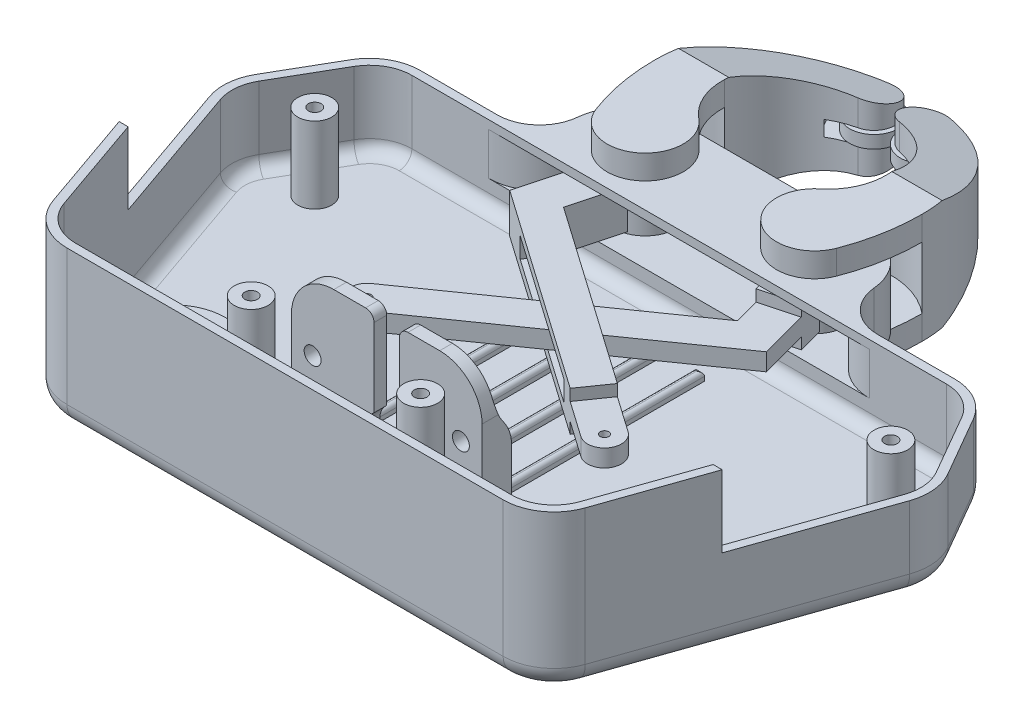
from build123d import *

# Parameters (mm, degrees)
BOSS_EXTRUDE1_DEPTH       = 2
BOSS_EXTRUDE2_DEPTH       = 35
SKETCH20_W                = 70
SKETCH20_H                = 20
CUT_EXTRUDE7_DEPTH        = 8
SKETCH21_W                = 70
SKETCH21_H                = 20
BOSS_EXTRUDE12_DEPTH      = 2
SKETCH22_W                = 66
SKETCH22_H                = 6
BOSS_EXTRUDE13_DEPTH      = 2
SKETCH23_W                = 70
SKETCH23_H                = 22
CUT_EXTRUDE8_DEPTH        = 19
SKETCH24_W                = 70
SKETCH24_H                = 22
BOSS_EXTRUDE16_DEPTH      = 2
SKETCH26_R                = 7.5
CUT_EXTRUDE9_DEPTH        = 177.062657243
BOSS_EXTRUDE18_DEPTH      = 10
SKETCH25_W                = 70
SKETCH25_H                = 2
BOSS_EXTRUDE17_DEPTH      = 17
FILLET8_R                 = 10
FILLET9_R                 = 12
BOSS_EXTRUDE22_START      = -14.3
SKETCH32_R                = 7.35
BOSS_EXTRUDE22_DEPTH      = 14.6
SKETCH34_R                = 6
SKETCH34_R_2              = 2.8
BOSS_EXTRUDE23_DEPTH      = 1.5
SKETCH36_R                = 2.5
BOSS_EXTRUDE24_DEPTH      = 1.8
BOSS_EXTRUDE25_DEPTH      = 11.2
BOSS_EXTRUDE26_DEPTH      = 5.7
BOSS_EXTRUDE27_DEPTH      = 5.7
BOSS_EXTRUDE28_DEPTH      = 11.2
BOSS_EXTRUDE29_DEPTH      = 3.6
CUT_EXTRUDE10_REACH       = 178.063
CUT_EXTRUDE11_START       = -1.5
SKETCH45_R                = 6
SKETCH45_R_2              = 5.75
CUT_EXTRUDE11_DEPTH       = 3
SKETCH8_W                 = 45
SKETCH8_H                 = 34
BOSS_EXTRUDE5_DEPTH       = 3
SKETCH9_W                 = 3
SKETCH9_H                 = 4
BOSS_EXTRUDE6_DEPTH       = 20
FILLET1_R                 = 10
FILLET2_R                 = 10
SKETCH11_R                = 12.5
BOSS_EXTRUDE9_DEPTH       = 10
CUT_EXTRUDE3_START        = -3
CUT_EXTRUDE3_DEPTH        = 5
SKETCH14_R                = 2.5
CUT_EXTRUDE4_DEPTH        = 8
SKETCH15_R                = 2
SKETCH15_R_2              = 4.65
CUT_EXTRUDE5_DEPTH        = 3
FILLET3_R                 = 10
FILLET4_R                 = 12
FILLET5_R                 = 10
FILLET6_R                 = 3
FILLET7_R                 = 5
CUT_EXTRUDE6_DEPTH        = 176.517870781
CUT_EXTRUDE6_DEPTH_BACK   = 176.517870781
SKETCH16_W                = 90
SKETCH16_H                = 20
SKETCH17_R                = 4
SKETCH17_R_2              = 1.5
BOSS_EXTRUDE10_DEPTH      = 18
SKETCH19_R                = 4
SKETCH19_R_2              = 1.5
BOSS_EXTRUDE11_DEPTH      = 35
SKETCH46_W                = 6
SKETCH46_H                = 24
CUT_EXTRUDE12_DEPTH       = 3
FILLET10_R                = 2
BOSS_EXTRUDE30_DEPTH      = 4.7
BOSS_EXTRUDE30_DEPTH_BACK = 4.7
SKETCH50_W                = 42.39696243
SKETCH50_H                = 4.8
CUT_EXTRUDE13_DEPTH       = 8
BOSS_EXTRUDE32_START      = -2
BOSS_EXTRUDE32_DEPTH      = 4.1
BOSS_EXTRUDE33_START      = -4.7
BOSS_EXTRUDE33_DEPTH      = 9.4
CUT_EXTRUDE14_DEPTH       = 2.7
CUT_EXTRUDE15_DEPTH       = 2.6
SKETCH55_R                = 1
CUT_EXTRUDE16_DEPTH       = 4.1
SKETCH56_W                = 2
SKETCH56_H                = 52
BOSS_EXTRUDE34_DEPTH      = 2
FILLET11_R                = 1
FILLET11_OF_MIRROR11_R    = 1


# Some blends are built 0.0001 mm under size
with BuildPart() as part:
    # Sketch1 → Boss-Extrude1 (new body)
    with BuildSketch(Plane(origin=(0, 0, 0), x_dir=(1, 0, 0), z_dir=(0, 1, 0))):
        Polygon((-70, -55), (-35, -55), (-35, -35), (35, -35), (35, -55), (70, -55), (84.43375673, -80), (60, -150), (-60, -150), (-84.43375673, -80), align=None)
    extrude(amount=BOSS_EXTRUDE1_DEPTH)

    # Sketch2 → Boss-Extrude2 (add)
    with BuildSketch(Plane(origin=(0, 2, 0), x_dir=(1, 0, 0), z_dir=(0, 1, 0))):
        Polygon((84.43375673, -80), (70, -55), (35, -55), (35, -35), (-35, -35), (-35, -55), (-70, -55), (-84.43375673, -80), (-60, -150), (60, -150), align=None)
        Polygon((68.845299462, -57), (33, -57), (33, -37), (-33, -37), (-33, -57), (-68.845299462, -57), (-82.243429624, -80.206242168), (-58.579769814, -148), (58.579769814, -148), (82.243429624, -80.206242168), align=None, mode=Mode.SUBTRACT)
    extrude(amount=BOSS_EXTRUDE2_DEPTH)

    # Sketch20 → Cut-Extrude7 (cut)
    with BuildSketch(Plane.XZ):
        with Locations((0, 45)):
            Rectangle(SKETCH20_W, SKETCH20_H)
    extrude(amount=-CUT_EXTRUDE7_DEPTH, mode=Mode.SUBTRACT)

    # Sketch21 → Boss-Extrude12 (add)
    with BuildSketch(Plane.XZ.offset(-8)):
        with Locations((0, 45)):
            Rectangle(SKETCH21_W, SKETCH21_H)
    extrude(amount=BOSS_EXTRUDE12_DEPTH)

    # Sketch22 → Boss-Extrude13 (add)
    with BuildSketch(Plane.XY.offset(55)):
        with Locations((0, 5)):
            Rectangle(SKETCH22_W, SKETCH22_H)
    extrude(amount=BOSS_EXTRUDE13_DEPTH)

    # Sketch23 → Cut-Extrude8 (cut)
    with BuildSketch(Plane(origin=(0, 37, 0), x_dir=(1, 0, 0), z_dir=(0, 1, 0))):
        with Locations((0, -46)):
            Rectangle(SKETCH23_W, SKETCH23_H)
    extrude(amount=-CUT_EXTRUDE8_DEPTH, mode=Mode.SUBTRACT)

    # Sketch24 → Boss-Extrude16 (add)
    with BuildSketch(Plane(origin=(0, 18, 0), x_dir=(1, 0, 0), z_dir=(0, 1, 0))):
        with Locations((0, -46)):
            Rectangle(SKETCH24_W, SKETCH24_H)
    extrude(amount=BOSS_EXTRUDE16_DEPTH)

    # Sketch26 → Cut-Extrude9 (cut, through all)
    with BuildSketch(Plane.XZ):
        with Locations(Location((20, 45, 0), (0, 0, 90))):
            Circle(SKETCH26_R)
        with Locations(Location((-20, 45, 0), (0, 0, 90))):
            Circle(SKETCH26_R)
    extrude(amount=-CUT_EXTRUDE9_DEPTH, mode=Mode.SUBTRACT)

    # Sketch27 → Boss-Extrude18 (add)
    with BuildSketch(Plane(origin=(0, 8, 0), x_dir=(1, 0, 0), z_dir=(0, 1, 0))):
        with BuildLine():
            Line((-29.5, -45), (-27.5, -45))
            ThreePointArc((-27.5, -45), (-20, -37.5), (-12.5, -45))
            Line((-12.5, -45), (-10.5, -45))
            ThreePointArc((-10.5, -45), (-20, -35.5), (-29.5, -45))
        make_face()
        with BuildLine():
            Line((29.5, -45), (27.5, -45))
            ThreePointArc((27.5, -45), (20, -37.5), (12.5, -45))
            Line((12.5, -45), (10.5, -45))
            ThreePointArc((10.5, -45), (20, -35.5), (29.5, -45))
        make_face()
    extrude(amount=BOSS_EXTRUDE18_DEPTH)

    # Sketch25 → Boss-Extrude17 (add)
    with BuildSketch(Plane(origin=(0, 20, 0), x_dir=(1, 0, 0), z_dir=(0, 1, 0))):
        with Locations((0, -56)):
            Rectangle(SKETCH25_W, SKETCH25_H)
    extrude(amount=BOSS_EXTRUDE17_DEPTH)

    # Fillet8
    # the kernel refuses this fillet: 10 mm, written as the material it adds along each edge
    with BuildSketch(Plane(origin=(-33, 8, 37), x_dir=(0, 0, 1), z_dir=(0, 1, 0))) as fillet8_piece_1:
        with BuildLine():
            CenterArc((9.771942094, 10), FILLET8_R, 192.259959565, 77.740040435)
            Line((0, 7.876524617), (-0.195438842, 7.834055109))
            ThreePointArc((-0.195438842, 7.834055109), (-0.2, 3.938262309), (-0.2, 0))
            Line((-0.2, 0), (0, -0.2))
            Line((0, -0.2), (9.771942094, -0.2))
            Line((9.771942094, -0.2), (9.771942094, 0))
        make_face()
    extrude(amount=10)
    with BuildSketch(Plane(origin=(33, 8, 37), x_dir=(-1, 0, 0), z_dir=(0, 1, 0))) as fillet8_piece_2:
        with BuildLine():
            CenterArc((10, 9.771942094), FILLET8_R, 180, 77.740040435)
            Line((0, 9.771942094), (-0.2, 9.771942094))
            Line((-0.2, 9.771942094), (-0.2, 0))
            Line((-0.2, 0), (0, -0.2))
            ThreePointArc((0, -0.2), (3.938262309, -0.2), (7.834055109, -0.195438842))
            Line((7.834055109, -0.195438842), (7.876524617, 0))
        make_face()
    extrude(amount=10)

    # Fillet9
    fillet9_edges = [part.edges().sort_by_distance(p)[0] for p in [
        (-35, 13, 35),
        (35, 13, 35),
    ]]
    fillet(fillet9_edges, radius=FILLET9_R)

    # Sketch8 → Boss-Extrude5 (add)
    with BuildSketch(Plane(origin=(0, 0, 126), x_dir=(-1, 0, 0), z_dir=(0, 0, -1))):
        with Locations((0, 19)):
            Rectangle(SKETCH8_W, SKETCH8_H)
    extrude(amount=BOSS_EXTRUDE5_DEPTH)

    # Sketch9 → Boss-Extrude6 (add)
    with BuildSketch(Plane(origin=(0, 2, 0), x_dir=(1, 0, 0), z_dir=(0, 1, 0))):
        with Locations((-21, -121)):
            Rectangle(SKETCH9_W, SKETCH9_H)
        with Locations((21, -121)):
            Rectangle(SKETCH9_W, SKETCH9_H)
    extrude(amount=BOSS_EXTRUDE6_DEPTH)

    # Fillet1
    # the kernel refuses this fillet: 10 mm, written as the material it adds along each edge
    with BuildSketch(Plane(origin=(-22.5, 22, 123), x_dir=(0, 1, 0), z_dir=(1, 0, 0))) as fillet1_piece_1:
        with BuildLine():
            CenterArc((8, -10), FILLET1_R, 90, 53.130102354)
            Line((0, -4), (-0.16, -3.88))
            ThreePointArc((-0.16, -3.88), (-0.2, -2), (-0.2, 0))
            Line((-0.2, 0), (0, 0.2))
            Line((0, 0.2), (8, 0.2))
            Line((8, 0.2), (8, 0))
        make_face()
    extrude(amount=3)
    with BuildSketch(Plane(origin=(22.5, 22, 123), x_dir=(0, 1, 0), z_dir=(-1, 0, 0))) as fillet1_piece_2:
        with BuildLine():
            CenterArc((8, 10), FILLET1_R, 216.869897646, 53.130102354)
            Line((0, 4), (-0.16, 3.88))
            ThreePointArc((-0.16, 3.88), (-0.2, 2), (-0.2, 0))
            Line((-0.2, 0), (0, -0.2))
            Line((0, -0.2), (8, -0.2))
            Line((8, -0.2), (8, 0))
        make_face()
    extrude(amount=3)

    # Fillet2
    fillet2_edges = [part.edges().sort_by_distance(p)[0] for p in [
        (-21, 22, 119),
        (21, 22, 119),
    ]]
    fillet(fillet2_edges, radius=FILLET2_R)

    # Sketch11 → Boss-Extrude9 (add)
    with BuildSketch(Plane(origin=(0, 2, 0), x_dir=(1, 0, 0), z_dir=(0, 1, 0))):
        with Locations(Location((-43.579769814, -133, 0), (0, 0, 90))):
            Circle(SKETCH11_R)
    boss_extrude9 = extrude(amount=BOSS_EXTRUDE9_DEPTH)

    # Sketch13 → Cut-Extrude3 (cut)
    with BuildSketch(Plane(origin=(0, 7, 0), x_dir=(1, 0, 0), z_dir=(0, 1, 0)).offset(CUT_EXTRUDE3_START)):
        with BuildLine():
            Line((-53.021135888, -136.295543455), (-58.294005416, -121.189357737))
            Line((-58.294005416, -121.189357737), (-39.411273269, -114.598270827))
            Line((-39.411273269, -114.598270827), (-34.138403741, -129.704456545))
            ThreePointArc((-34.138403741, -129.704456545), (-40.28422636, -142.441366074), (-53.021135888, -136.295543455))
        make_face()
    cut_extrude3 = extrude(amount=CUT_EXTRUDE3_DEPTH, mode=Mode.SUBTRACT)

    # Sketch14 → Cut-Extrude4 (cut)
    with BuildSketch(Plane(origin=(0, 12, 0), x_dir=(1, 0, 0), z_dir=(0, 1, 0))):
        with Locations(Location((-43.579769814, -133, 0), (0, 0, 270))):
            Circle(SKETCH14_R)
    cut_extrude4 = extrude(amount=-CUT_EXTRUDE4_DEPTH, mode=Mode.SUBTRACT)

    # Sketch15 → Cut-Extrude5 (cut)
    with BuildSketch(Plane.XY.offset(126)):
        with Locations((17.5, 20)):
            Circle(SKETCH15_R)
        with Locations((-17.5, 20)):
            Circle(SKETCH15_R)
        with Locations((0, 12)):
            Circle(SKETCH15_R_2)
    extrude(amount=-CUT_EXTRUDE5_DEPTH, mode=Mode.SUBTRACT)

    # Fillet3
    # the kernel refuses this fillet: 10 mm, written as the material it adds along each edge
    with BuildSketch(Plane(origin=(-35, 20, 55), x_dir=(-1, 0, 0), z_dir=(0, -1, 0)), Plane(origin=(35, 6, 55), x_dir=(1, 0, 0), z_dir=(0, 1, 0))) as fillet3_piece_1:
        with BuildLine():
            CenterArc((9.9089023, 10), FILLET3_R, 185.21590857, 84.78409143)
            Line((-0.049689654, 9.090909091), (-1.04554885, 9))
            ThreePointArc((-1.04554885, 9), (-1, 8), (-1, 0))
            Line((-1, 0), (0, -1))
            Line((0, -1), (9.9089023, -1))
            Line((9.9089023, -1), (9.9089023, 0))
        make_face()
    extrude(amount=14)
    with BuildSketch(Plane(origin=(58.579769814, 2, 148), x_dir=(0.3295543454864914, 0, -0.9441366073672656), z_dir=(0, 1, 0)), Plane(origin=(-58.579769814, 2, 148), x_dir=(1, 0, 0), z_dir=(0, 1, 0))) as fillet3_piece_2:
        with BuildLine():
            CenterArc((FILLET3_R * 0.710115092754, FILLET3_R), FILLET3_R, 199.241728317, 70.758271683)
            Line((-FILLET3_R * 0.234021514613, FILLET3_R * 0.670445654514), (0, 0))
            Line((0, 0), (FILLET3_R * 0.710115092754, 0))
        make_face()
    extrude(amount=35)
    with BuildSketch(Plane(origin=(82.243429624, 2, 80.206242168), x_dir=(-0.49999999999999883, 0, -0.8660254037844394), z_dir=(0, 1, 0))) as fillet3_piece_3:
        with BuildLine():
            CenterArc((FILLET3_R * 0.45827629813, FILLET3_R), FILLET3_R, 220.758271683, 49.241728317)
            Line((-FILLET3_R * 0.299194440672, FILLET3_R * 0.34713088612), (0, 0))
            Line((0, 0), (FILLET3_R * 0.45827629813, 0))
        make_face()
    extrude(amount=35)
    with BuildSketch(Plane(origin=(68.845299462, 2, 57), x_dir=(0.49999999999999817, 0, 0.8660254037844396), z_dir=(0, 1, 0)), Plane(origin=(-68.845299462, 2, 57), x_dir=(1, 0, 0), z_dir=(0, 1, 0))) as fillet3_piece_4:
        with BuildLine():
            CenterArc((FILLET3_R * 0.57735026919, -FILLET3_R), FILLET3_R, 90, 60)
            Line((-FILLET3_R * 0.288675134595, -FILLET3_R * 0.5), (0, 0))
            Line((0, 0), (FILLET3_R * 0.57735026919, 0))
        make_face()
    extrude(amount=35)
    with BuildSketch(Plane(origin=(-82.243429624, 2, 80.206242168), x_dir=(0.5000000000000008, 0, -0.8660254037844383), z_dir=(0, 1, 0))) as fillet3_piece_5:
        with BuildLine():
            CenterArc((FILLET3_R * 0.45827629813, -FILLET3_R), FILLET3_R, 90, 49.241728317)
            Line((-FILLET3_R * 0.299194440672, -FILLET3_R * 0.34713088612), (0, 0))
            Line((0, 0), (FILLET3_R * 0.45827629813, 0))
        make_face()
    extrude(amount=35)

    # Fillet4
    # the kernel refuses this fillet: 12 mm, written as the material it takes off along each edge
    with BuildSketch(Plane(origin=(-60, -21.303452783, 150), x_dir=(-0.3295543454864913, 0, -0.9441366073672655), z_dir=(0, 1, 0)), Plane(origin=(60, 58.303452783, 150), x_dir=(0.3295543454864903, 0, -0.9441366073672659), z_dir=(0, -1, 0))) as fillet4_piece_1:
        with BuildLine():
            CenterArc((FILLET4_R * 0.710115092754, -FILLET4_R), FILLET4_R, 90, 70.758271683)
            Line((-FILLET4_R * 0.234021514613, -FILLET4_R * 0.670445654514), (0, 0))
            Line((0, 0), (FILLET4_R * 0.710115092754, 0))
        make_face()
    extrude(amount=79.606905565, mode=Mode.SUBTRACT)
    with BuildSketch(Plane(origin=(-84.43375673, -13.748288944, 80), x_dir=(0.3295543454864903, 0, 0.944136607367266), z_dir=(0, 1, 0))) as fillet4_piece_2:
        with BuildLine():
            CenterArc((FILLET4_R * 0.45827629813, FILLET4_R), FILLET4_R, 220.758271683, 49.241728317)
            Line((-FILLET4_R * 0.299194440672, FILLET4_R * 0.34713088612), (0, 0))
            Line((0, 0), (FILLET4_R * 0.45827629813, 0))
        make_face()
    extrude(amount=64.496577888, mode=Mode.SUBTRACT)
    with BuildSketch(Plane(origin=(-70, -17.320508076, 55), x_dir=(-0.49999999999999767, 0, 0.8660254037844399), z_dir=(0, 1, 0))) as fillet4_piece_3:
        with BuildLine():
            CenterArc((FILLET4_R * 0.57735026919, FILLET4_R), FILLET4_R, 210, 60)
            Line((-FILLET4_R * 0.288675134595, FILLET4_R * 0.5), (0, 0))
            Line((0, 0), (FILLET4_R * 0.57735026919, 0))
        make_face()
    extrude(amount=71.641016151, mode=Mode.SUBTRACT)
    with BuildSketch(Plane(origin=(-33, 8, 57), x_dir=(-1, 0, 0), z_dir=(0, 1, 0))) as fillet4_piece_4:
        with BuildLine():
            CenterArc((11.928525286, -12), FILLET4_R, 90, 85.380232139)
            Line((-0.032488506, -11.03348613), (-1.228589886, -10.936834743))
            ThreePointArc((-1.228589886, -10.936834743), (-1.2, -10.228057906), (-1.2, 0))
            Line((-1.2, 0), (0, 1.2))
            Line((0, 1.2), (11.928525286, 1.2))
            Line((11.928525286, 1.2), (11.928525286, 0))
        make_face()
    extrude(amount=10, mode=Mode.SUBTRACT)
    with BuildSketch(Plane(origin=(33, 8, 57), x_dir=(1, 0, 0), z_dir=(0, 1, 0))) as fillet4_piece_5:
        with BuildLine():
            CenterArc((11.928525286, 12), FILLET4_R, 184.619767861, 85.380232139)
            Line((-0.032488506, 11.03348613), (-1.228589886, 10.936834743))
            ThreePointArc((-1.228589886, 10.936834743), (-1.2, 10.228057906), (-1.2, 0))
            Line((-1.2, 0), (0, -1.2))
            Line((0, -1.2), (11.928525286, -1.2))
            Line((11.928525286, -1.2), (11.928525286, 0))
        make_face()
    extrude(amount=10, mode=Mode.SUBTRACT)
    with BuildSketch(Plane(origin=(70, 54.320508076, 55), x_dir=(-1, 0, 0), z_dir=(0, -1, 0))) as fillet4_piece_6:
        with BuildLine():
            CenterArc((FILLET4_R * 0.57735026919, -FILLET4_R), FILLET4_R, 90, 60)
            Line((-FILLET4_R * 0.288675134595, -FILLET4_R * 0.5), (0, 0))
            Line((0, 0), (FILLET4_R * 0.57735026919, 0))
        make_face()
    extrude(amount=71.641016151, mode=Mode.SUBTRACT)
    with BuildSketch(Plane(origin=(84.43375673, 50.748288944, 80), x_dir=(-0.499999999999997, 0, -0.8660254037844405), z_dir=(0, -1, 0))) as fillet4_piece_7:
        with BuildLine():
            CenterArc((FILLET4_R * 0.45827629813, -FILLET4_R), FILLET4_R, 90, 49.241728317)
            Line((-FILLET4_R * 0.299194440672, -FILLET4_R * 0.34713088612), (0, 0))
            Line((0, 0), (FILLET4_R * 0.45827629813, 0))
        make_face()
    extrude(amount=64.496577888, mode=Mode.SUBTRACT)

    # Fillet5
    fillet5_edges = [part.edges().sort_by_distance(p)[0] for p in [
        (22.5, 36, 124.5),
        (-22.5, 36, 124.5),
    ]]
    fillet(fillet5_edges, radius=FILLET5_R)

    # Fillet6
    # the kernel refuses this fillet: 3 mm, written as the material it adds along each edge
    with BuildSketch(Plane(origin=(-51.478618887, 2, 148), x_dir=(0, 0, -1), z_dir=(1, 0, 0))) as fillet6_piece_1:
        with BuildLine():
            CenterArc((FILLET6_R, FILLET6_R), FILLET6_R, 180, 90)
            Line((0, FILLET6_R), (0, 0))
            Line((0, 0), (FILLET6_R, 0))
        make_face()
    extrude(amount=102.957237774)
    with BuildSketch(Plane(origin=(-63.07179677, 2, 57), x_dir=(0, 0, 1), z_dir=(1, 0, 0))) as fillet6_piece_2:
        with BuildLine():
            CenterArc((FILLET6_R, -FILLET6_R), FILLET6_R, 90, 90)
            Line((0, -FILLET6_R), (0, 0))
            Line((0, 0), (FILLET6_R, 0))
        make_face()
    extrude(amount=126.143593539)
    with BuildSketch(Plane(origin=(-71.732050808, 2, 62), x_dir=(0.8660254037844374, 0, 0.5000000000000022), z_dir=(-0.5000000000000022, 0, 0.8660254037844374)), Plane(origin=(79.952048133, 2, 76.237453006), x_dir=(-0.8660254037844397, 0, 0.4999999999999984), z_dir=(-0.49999999999999833, 0, -0.8660254037844397))) as fillet6_piece_3:
        with BuildLine():
            CenterArc((FILLET6_R, FILLET6_R), FILLET6_R, 180, 90)
            Line((0, FILLET6_R), (0, 0))
            Line((0, 0), (FILLET6_R, 0))
        make_face()
    extrude(amount=16.439994652)
    with BuildSketch(Plane(origin=(-80.733160169, 2, 84.532996461), x_dir=(0.9441366073672651, 0, -0.329554345486493), z_dir=(0.329554345486493, 0, 0.9441366073672651)), Plane(origin=(60.919984961, 2, 141.295543455), x_dir=(-0.9441366073672659, 0, -0.32955434548649076), z_dir=(0.3295543454864908, 0, -0.9441366073672659))) as fillet6_piece_4:
        with BuildLine():
            CenterArc((FILLET6_R, FILLET6_R), FILLET6_R, 180, 90)
            Line((0, FILLET6_R), (0, 0))
            Line((0, 0), (FILLET6_R, 0))
        make_face()
    extrude(amount=60.121116532)
    with BuildSketch(Plane(origin=(-63.07179677, 2, 67), x_dir=(0, 0, -1), z_dir=(1, 0, 0))) as fillet6_piece_5:
        with BuildLine():
            CenterArc((10 - FILLET6_R, FILLET6_R), FILLET6_R, 270, 90)
            Line((10, FILLET6_R), (10, 0))
            Line((10, 0), (10 - FILLET6_R, 0))
        make_face()
    revolve(axis=Axis((-63.07179677, 2, 67), (0, 1, 0)), revolution_arc=60)
    with BuildSketch(Plane(origin=(-71.291794096, 2, 81.237453006), x_dir=(-0.8660254037843294, 0, -0.5000000000001894), z_dir=(0.5000000000001894, 0, -0.8660254037843294))) as fillet6_piece_6:
        with BuildLine():
            CenterArc((10 - FILLET6_R, FILLET6_R), FILLET6_R, 270, 90)
            Line((10, FILLET6_R), (10, 0))
            Line((10, 0), (10 - FILLET6_R, 0))
        make_face()
    revolve(axis=Axis((-71.291794096, 2, 81.237453006), (0, 1, 0)), revolution_arc=49.241728317)
    with BuildSketch(Plane(origin=(63.07179677, 2, 67), x_dir=(0.8660254037843291, 0, -0.5000000000001898), z_dir=(0.5000000000001898, 0, 0.8660254037843291))) as fillet6_piece_7:
        with BuildLine():
            CenterArc((10 - FILLET6_R, FILLET6_R), FILLET6_R, 270, 90)
            Line((10, FILLET6_R), (10, 0))
            Line((10, 0), (10 - FILLET6_R, 0))
        make_face()
    revolve(axis=Axis((63.07179677, 2, 67), (0, 1, 0)), revolution_arc=60)
    with BuildSketch(Plane(origin=(71.291794096, 2, 81.237453006), x_dir=(0.9441366073673358, 0, 0.32955434548629065), z_dir=(-0.32955434548629065, 0, 0.9441366073673358))) as fillet6_piece_8:
        with BuildLine():
            CenterArc((10 - FILLET6_R, FILLET6_R), FILLET6_R, 270, 90)
            Line((10, FILLET6_R), (10, 0))
            Line((10, 0), (10 - FILLET6_R, 0))
        make_face()
    revolve(axis=Axis((71.291794096, 2, 81.237453006), (0, 1, 0)), revolution_arc=49.241728317)
    with BuildSketch(Plane(origin=(-51.478618887, 2, 138), x_dir=(-0.9441366073672636, 0, 0.32955434548649704), z_dir=(-0.32955434548649704, 0, -0.9441366073672636))) as fillet6_piece_9:
        with BuildLine():
            CenterArc((10 - FILLET6_R, FILLET6_R), FILLET6_R, 270, 90)
            Line((10, FILLET6_R), (10, 0))
            Line((10, 0), (10 - FILLET6_R, 0))
        make_face()
    revolve(axis=Axis((-51.478618887, 2, 138), (0, 1, 0)), revolution_arc=70.758271683)
    with BuildSketch(Plane(origin=(51.478618887, 2, 138), x_dir=(0, 0, 1), z_dir=(-1, 0, 0))) as fillet6_piece_10:
        with BuildLine():
            CenterArc((10 - FILLET6_R, FILLET6_R), FILLET6_R, 270, 90)
            Line((10, FILLET6_R), (10, 0))
            Line((10, 0), (10 - FILLET6_R, 0))
        make_face()
    revolve(axis=Axis((51.478618887, 2, 138), (0, 1, 0)), revolution_arc=70.758271683)

    # Fillet7
    fillet7_edges = [part.edges().sort_by_distance(p)[0] for p in [
        (0, 0, 150),
        (0, 0, 55),
        (77.574100278, 0, 68.118726503),
        (72.71484578, 0, 113.573378649),
        (-72.71484578, 0, 113.573378649),
        (-77.574100278, 0, 68.118726503),
        (83.238948111, 0, 80.112503707),
        (58.426430566, 0, 147.784064231),
        (69.07179677, 0, 56.607695155),
        (-69.07179677, 0, 56.607695155),
        (-83.238948111, 0, 80.112503707),
        (-58.426430566, 0, 147.784064231),
    ]]
    fillet(fillet7_edges, radius=FILLET7_R)

    # Sketch16 → Cut-Extrude6 (cut, two sides: drawn at the far end of the back side and taken through both)
    with BuildSketch(Plane(origin=(0, 0, 0), x_dir=(0, 0, -1), z_dir=(1, 0, 0)).offset(-CUT_EXTRUDE6_DEPTH_BACK)):
        with Locations((-73, 30)):
            Rectangle(SKETCH16_W, SKETCH16_H)
    extrude(amount=CUT_EXTRUDE6_DEPTH + CUT_EXTRUDE6_DEPTH_BACK, mode=Mode.SUBTRACT)

    # Sketch17 → Boss-Extrude10 (add)
    # profile 1 of 2: a face of its own
    with BuildSketch(Plane(origin=(0, 2, 0), x_dir=(1, 0, 0), z_dir=(0, 1, 0))):
        with Locations(Location((-68, -75, 0), (0, 0, 90))):
            Circle(SKETCH17_R)
        with Locations(Location((-68, -75, 0), (0, 0, 270))):
            Circle(SKETCH17_R_2, mode=Mode.SUBTRACT)
    # profile 2 of 2: a face of its own
    with BuildSketch(Plane(origin=(0, 2, 0), x_dir=(1, 0, 0), z_dir=(0, 1, 0))):
        with Locations(Location((68, -75, 0), (0, 0, 90))):
            Circle(SKETCH17_R)
        with Locations(Location((68, -75, 0), (0, 0, 90))):
            Circle(SKETCH17_R_2, mode=Mode.SUBTRACT)
    extrude(amount=BOSS_EXTRUDE10_DEPTH)

    # Sketch19 → Boss-Extrude11 (add)
    # profile 1 of 2: a face of its own
    with BuildSketch(Plane(origin=(0, 2, 0), x_dir=(1, 0, 0), z_dir=(0, 1, 0))):
        with Locations(Location((-20, -138, 0), (0, 0, 90))):
            Circle(SKETCH19_R)
        with Locations(Location((-20, -138, 0), (0, 0, 270))):
            Circle(SKETCH19_R_2, mode=Mode.SUBTRACT)
    # profile 2 of 2: a face of its own
    with BuildSketch(Plane(origin=(0, 2, 0), x_dir=(1, 0, 0), z_dir=(0, 1, 0))):
        with Locations(Location((20, -138, 0), (0, 0, 90))):
            Circle(SKETCH19_R)
        with Locations(Location((20, -138, 0), (0, 0, 90))):
            Circle(SKETCH19_R_2, mode=Mode.SUBTRACT)
    extrude(amount=BOSS_EXTRUDE11_DEPTH)

    # Sketch46 → Cut-Extrude12 (cut)
    with BuildSketch(Plane.XY.offset(126)):
        with Locations((0, 24)):
            Rectangle(SKETCH46_W, SKETCH46_H)
    extrude(amount=-CUT_EXTRUDE12_DEPTH, mode=Mode.SUBTRACT)

    # Fillet10
    fillet10_edges = [part.edges().sort_by_distance(p)[0] for p in [
        (3, 36, 124.5),
        (-3, 36, 124.5),
    ]]
    fillet(fillet10_edges, radius=FILLET10_R)

    # Mirror9: Boss-Extrude9, Cut-Extrude3, Cut-Extrude4 across plane
    add(boss_extrude9.mirror(Plane(origin=(0, 0, 0), x_dir=(0, 0, 1), z_dir=(1, 0, 0))))
    add(cut_extrude3.mirror(Plane(origin=(0, 0, 0), x_dir=(0, 0, 1), z_dir=(1, 0, 0))), mode=Mode.SUBTRACT)
    add(cut_extrude4.mirror(Plane(origin=(0, 0, 0), x_dir=(0, 0, 1), z_dir=(1, 0, 0))), mode=Mode.SUBTRACT)

    # Sketch56 → Boss-Extrude34 (add)
    with BuildSketch(Plane(origin=(0, 2, 0), x_dir=(1, 0, 0), z_dir=(0, 1, 0))):
        with Locations((-15, -93)):
            Rectangle(SKETCH56_W, SKETCH56_H)
        with Locations((-5, -93)):
            Rectangle(SKETCH56_W, SKETCH56_H)
    boss_extrude34 = extrude(amount=BOSS_EXTRUDE34_DEPTH)

    # Fillet11
    fillet11_edges = [part.edges().sort_by_distance(p)[0] for p in [
        (-16, 4, 93),
        (-15, 4, 119),
        (-14, 4, 93),
        (-15, 4, 67),
        (-6, 4, 93),
        (-5, 4, 119),
        (-4, 4, 93),
        (-5, 4, 67),
    ]]
    fillet(fillet11_edges, radius=FILLET11_R - 0.0001)  # a hair under: the kernel refuses the full size

    # Mirror11: Boss-Extrude34 across plane
    add(boss_extrude34.mirror(Plane(origin=(0, 0, 0), x_dir=(0, 0, 1), z_dir=(1, 0, 0))))

    # Fillet11 of Mirror11
    fillet11_of_mirror11_edges = [part.edges().sort_by_distance(p)[0] for p in [
        (16, 4, 93),
        (15, 4, 119),
        (14, 4, 93),
        (15, 4, 67),
        (6, 4, 93),
        (5, 4, 119),
        (4, 4, 93),
        (5, 4, 67),
    ]]
    fillet(fillet11_of_mirror11_edges, radius=FILLET11_OF_MIRROR11_R - 0.0001)  # a hair under: the kernel refuses the full size


with BuildPart() as body_2:
    # Sketch32 → Boss-Extrude22 (new body)
    with BuildSketch(Plane.XZ.offset(-6).offset(BOSS_EXTRUDE22_START)):
        with Locations(Location((-20, 45, 0), (0, 0, 270))):
            Circle(SKETCH32_R)
    extrude(amount=BOSS_EXTRUDE22_DEPTH)



with BuildPart() as body_3:
    # Sketch34 → Boss-Extrude23 (new, symmetric)
    with BuildSketch(Plane(origin=(0, 13, 0), x_dir=(-1, 0, 0), z_dir=(0, -1, 0))):
        with Locations(Location((6, -5, 0), (0, 0, 90))):
            Circle(SKETCH34_R)
        with Locations(Location((6, -5, 0), (0, 0, 90))):
            Circle(SKETCH34_R_2, mode=Mode.SUBTRACT)
    extrude(amount=BOSS_EXTRUDE23_DEPTH, both=True)

    # Sketch45 → Cut-Extrude11 (cut)
    with BuildSketch(Plane(origin=(0, 13, 0), x_dir=(-1, 0, 0), z_dir=(0, -1, 0)).offset(CUT_EXTRUDE11_START)):
        with Locations((6, -5)):
            Circle(SKETCH45_R)
        with Locations(Location((6, -5, 0), (0, 0, 90))):
            Circle(SKETCH45_R_2, mode=Mode.SUBTRACT)
    extrude(amount=CUT_EXTRUDE11_DEPTH, mode=Mode.SUBTRACT)


with BuildPart() as body_4:
    # Sketch36 → Boss-Extrude24 (new, symmetric)
    with BuildSketch(Plane(origin=(0, 13, 0), x_dir=(-1, 0, 0), z_dir=(0, -1, 0))):
        with Locations(Location((6, -5, 0), (0, 0, 90))):
            Circle(SKETCH36_R)
    extrude(amount=BOSS_EXTRUDE24_DEPTH, both=True)

    # Sketch37 → Boss-Extrude25 (add)
    with BuildSketch(Plane.XZ.offset(-11.2)):
        with BuildLine():
            ThreePointArc((-4.934956272, 9.885251463), (-1.129982148, 3.867336714), (-7.200065171, 0.146151673))
            ThreePointArc((-7.200065171, 0.146151673), (-24.716854546, 11.474930279), (-31.542149188, 31.187730378))
            ThreePointArc((-31.542149188, 31.187730378), (-25.81316871, 27.964534948), (-19.308915953, 27.01327148))
            ThreePointArc((-19.308915953, 27.01327148), (-15.045508823, 15.995777869), (-4.934956272, 9.885251463))
        make_face()
    extrude(amount=BOSS_EXTRUDE25_DEPTH)


with BuildPart() as body_2_1:
    add(body_2.part)

    add(body_4.part)  # Boss-Extrude26 merges body 4
    # Sketch39 → Boss-Extrude26 (add)
    with BuildSketch(Plane.XZ.offset(-5.7)):
        with BuildLine():
            ThreePointArc((-14.335275588, 38.006367372), (-14.71217883, 52.282784308), (-28.403824694, 48.221138077))
            ThreePointArc((-28.403824694, 48.221138077), (-30.75797131, 39.84906387), (-31.542149188, 31.187730378))
            ThreePointArc((-31.542149188, 31.187730378), (-25.81316871, 27.964534948), (-19.308915953, 27.01327148))
            ThreePointArc((-19.308915953, 27.01327148), (-18.123934022, 33.098814131), (-14.335275588, 38.006367372))
        make_face()
    extrude(amount=BOSS_EXTRUDE26_DEPTH)

    # Sketch40 → Boss-Extrude27 (add)
    with BuildSketch(Plane(origin=(0, 20.3, 0), x_dir=(1, 0, 0), z_dir=(0, 1, 0))):
        with BuildLine():
            ThreePointArc((-28.403824694, -48.221138077), (-14.71217883, -52.282784308), (-14.335275588, -38.006367372))
            ThreePointArc((-14.335275588, -38.006367372), (-18.123934022, -33.098814131), (-19.308915953, -27.01327148))
            ThreePointArc((-19.308915953, -27.01327148), (-25.81316871, -27.964534948), (-31.542149188, -31.187730378))
            ThreePointArc((-31.542149188, -31.187730378), (-30.75797131, -39.84906387), (-28.403824694, -48.221138077))
        make_face()
    extrude(amount=BOSS_EXTRUDE27_DEPTH)

    # Sketch41 → Boss-Extrude28 (add)
    with BuildSketch(Plane(origin=(0, 14.8, 0), x_dir=(1, 0, 0), z_dir=(0, 1, 0))):
        with BuildLine():
            ThreePointArc((-4.934956272, -9.885251463), (-1.129982148, -3.867336714), (-7.200065171, -0.146151673))
            ThreePointArc((-7.200065171, -0.146151673), (-24.716854546, -11.474930279), (-31.542149188, -31.187730378))
            ThreePointArc((-31.542149188, -31.187730378), (-25.81316871, -27.964534948), (-19.308915953, -27.01327148))
            ThreePointArc((-19.308915953, -27.01327148), (-15.045508823, -15.995777869), (-4.934956272, -9.885251463))
        make_face()
    extrude(amount=BOSS_EXTRUDE28_DEPTH)

    # Sketch43 → Boss-Extrude29 (add)
    with BuildSketch(Plane(origin=(0, 11.2, 0), x_dir=(1, 0, 0), z_dir=(0, 1, 0))):
        with BuildLine():
            ThreePointArc((-10.587116778, -12.156001654), (-16.807664842, -18.49295009), (-19.308915953, -27.01327148))
            ThreePointArc((-19.308915953, -27.01327148), (-25.81316871, -27.964534948), (-31.542149188, -31.187730378))
            ThreePointArc((-31.542149188, -31.187730378), (-26.852995772, -14.554309311), (-14.204510666, -2.778287883))
            ThreePointArc((-14.204510666, -2.778287883), (-13.930435805, -8.059115549), (-10.587116778, -12.156001654))
        make_face()
    extrude(amount=BOSS_EXTRUDE29_DEPTH)

    # Sketch44 → Cut-Extrude10 (cut, up to next)
    with BuildSketch(Plane(origin=(0, 0, 0), x_dir=(0, 0, -1), z_dir=(1, 0, 0)), mode=Mode.PRIVATE) as cut_extrude10_sk1:
        Polygon((0, 17.8), (-26.01327148, 26), (0, 26), align=None)
    cut_extrude10_tool1 = extrude(cut_extrude10_sk1.sketch, amount=-CUT_EXTRUDE10_REACH, mode=Mode.PRIVATE) & body_2_1.part
    # Sketch44 → Cut-Extrude10 (cut, up to next)
    with BuildSketch(Plane(origin=(0, 0, 0), x_dir=(0, 0, -1), z_dir=(1, 0, 0)), mode=Mode.PRIVATE) as cut_extrude10_sk2:
        Polygon((0, 8.2), (-26.01327148, 0), (0, 0), align=None)
    cut_extrude10_tool2 = extrude(cut_extrude10_sk2.sketch, amount=-CUT_EXTRUDE10_REACH, mode=Mode.PRIVATE) & body_2_1.part
    add(cut_extrude10_tool1.solids().sort_by_distance((0, 23.266667, 8.67109))[0], mode=Mode.SUBTRACT)
    add(cut_extrude10_tool2.solids().sort_by_distance((0, 2.733333, 8.67109))[0], mode=Mode.SUBTRACT)


with BuildPart() as body_4_2:
    # Mirror8: mirrored copy
    add(body_2_1.part.mirror(Plane(origin=(0, 0, 0), x_dir=(0, 0, 1), z_dir=(1, 0, 0))))


with BuildPart() as body_5:
    # Mirror8 2: mirrored copy
    add(body_3.part.mirror(Plane(origin=(0, 0, 0), x_dir=(0, 0, 1), z_dir=(1, 0, 0))))


with BuildPart() as body_6:
    # Sketch49 → Boss-Extrude30 (new, two sides: drawn at the far end of the back side and taken through both)
    with BuildSketch(Plane(origin=(0, 13, 0), x_dir=(-1, 0, 0), z_dir=(0, -1, 0)).offset(-BOSS_EXTRUDE30_DEPTH_BACK)):
        with BuildLine():
            Line((30.307813145, -66.662172993), (-25.719698453, -105.893058961))
            ThreePointArc((-25.719698453, -105.893058961), (-31.290612375, -104.910756529), (-30.308309943, -99.339842606))
            Line((-30.308309943, -99.339842606), (17.905213591, -65.580369984))
            Line((17.905213591, -65.580369984), (20.520383785, -63.749208101))
            Line((20.520383785, -63.749208101), (17.331602636, -51.848514839))
            ThreePointArc((17.331602636, -51.848514839), (21.902319982, -52.099554823), (25.735157325, -49.596789147))
            Line((25.735157325, -49.596789147), (30.307813145, -66.662172993))
        make_face()
    extrude(amount=BOSS_EXTRUDE30_DEPTH + BOSS_EXTRUDE30_DEPTH_BACK)

    # Sketch50 → Cut-Extrude13 (cut)
    with BuildSketch(Plane(origin=(-41.291941298, 0, 58.971003659), x_dir=(0.819152044288991, 0, 0.5735764363510474), z_dir=(-0.5735764363510473, 0, 0.8191520442889909))):
        with Locations((44.607625744, 13)):
            Rectangle(SKETCH50_W, SKETCH50_H)
    extrude(amount=-CUT_EXTRUDE13_DEPTH, mode=Mode.SUBTRACT)


with BuildPart() as body_2_2:
    add(body_2_1.part)

    add(body_6.part)  # Boss-Extrude32 merges body 6

    add(body_4_2.part)  # Boss-Extrude32 merges body 4 2
    # Sketch51 → Boss-Extrude32 (add)
    with BuildSketch(Plane(origin=(0, 13, 0), x_dir=(-1, 0, 0), z_dir=(0, -1, 0)).offset(BOSS_EXTRUDE32_START)):
        with BuildLine():
            Line((30.308309943, -99.339842606), (-20.520383785, -63.749208101))
            Line((-20.520383785, -63.749208101), (-17.331602636, -51.848514839))
            ThreePointArc((-17.331602636, -51.848514839), (-21.902319982, -52.099554823), (-25.735157325, -49.596789147))
            Line((-25.735157325, -49.596789147), (-30.307813145, -66.662172993))
            Line((-30.307813145, -66.662172993), (25.719698453, -105.893058961))
            ThreePointArc((25.719698453, -105.893058961), (31.290612375, -104.910756529), (30.308309943, -99.339842606))
        make_face()
    extrude(amount=BOSS_EXTRUDE32_DEPTH)

    # Sketch52 → Boss-Extrude33 (add)
    with BuildSketch(Plane(origin=(0, 13, 0), x_dir=(-1, 0, 0), z_dir=(0, -1, 0)).offset(BOSS_EXTRUDE33_START)):
        with BuildLine():
            Line((-25.735157325, -49.596789147), (-27.307605886, -55.465247069))
            Line((-27.307605886, -55.465247069), (-18.904051197, -57.716972762))
            Line((-18.904051197, -57.716972762), (-17.331602636, -51.848514839))
            ThreePointArc((-17.331602636, -51.848514839), (-21.902319982, -52.099554823), (-25.735157325, -49.596789147))
        make_face()
    extrude(amount=BOSS_EXTRUDE33_DEPTH)

    # Sketch53 → Cut-Extrude14 (cut)
    with BuildSketch(Plane(origin=(0, 17.7, 0), x_dir=(1, 0, 0), z_dir=(0, 1, 0))):
        with BuildLine():
            Line((21.879223866, -93.437732995), (30.308309943, -99.339842606))
            ThreePointArc((30.308309943, -99.339842606), (31.290612375, -104.910756529), (25.719698453, -105.893058961))
            Line((25.719698453, -105.893058961), (17.290612375, -99.990949349))
            Line((17.290612375, -99.990949349), (21.879223866, -93.437732995))
        make_face()
    extrude(amount=-CUT_EXTRUDE14_DEPTH, mode=Mode.SUBTRACT)

    # Sketch54 → Cut-Extrude15 (cut)
    with BuildSketch(Plane.XZ.offset(-8.3)):
        with BuildLine():
            Line((25.719698453, 105.893058961), (17.290612375, 99.990949349))
            Line((17.290612375, 99.990949349), (21.879223866, 93.437732995))
            Line((21.879223866, 93.437732995), (30.308309943, 99.339842606))
            ThreePointArc((30.308309943, 99.339842606), (31.290612375, 104.910756529), (25.719698453, 105.893058961))
        make_face()
    extrude(amount=-CUT_EXTRUDE15_DEPTH, mode=Mode.SUBTRACT)

    # Sketch55 → Cut-Extrude16 (cut)
    with BuildSketch(Plane(origin=(0, 15, 0), x_dir=(1, 0, 0), z_dir=(0, 1, 0))):
        with Locations(Location((-28.014004198, -102.616450783, 0), (0, 0, 270))):
            Circle(SKETCH55_R)
        with Locations(Location((28.014004198, -102.616450783, 0), (0, 0, 270))):
            Circle(SKETCH55_R)
    extrude(amount=-CUT_EXTRUDE16_DEPTH, mode=Mode.SUBTRACT)


solid = Compound([part.part, body_3.part, body_5.part, body_2_2.part])
